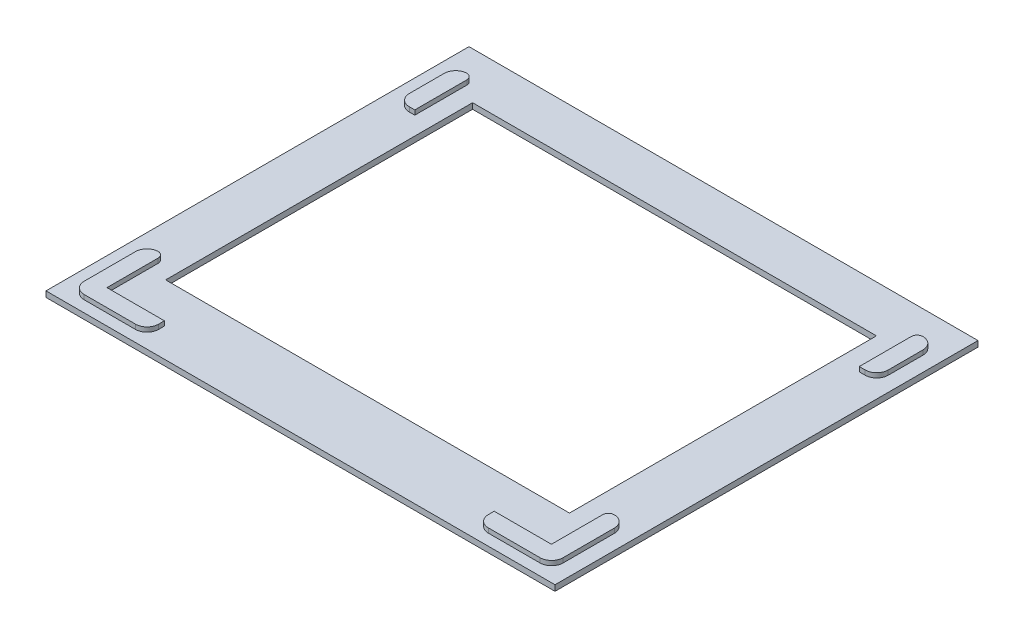
from build123d import *

# Parameters (mm, degrees)
BOSS_EXTRUDE2_DEPTH   = 1.016
BOSS_EXTRUDE2_2_DEPTH = 1.016
SKETCH2_W             = 3.747831998
SKETCH2_H             = 12.799678195
BOSS_EXTRUDE2_3_DEPTH = 1.016
SKETCH2_W_2           = 3.862926877
BOSS_EXTRUDE2_4_DEPTH = 1.016
SKETCH2_7_W           = 112.7125
SKETCH2_7_H           = 93.6625
BOSS_EXTRUDE14_DEPTH  = 1.27
SKETCH2_8_W           = 89.425
SKETCH2_8_H           = 67.9625
CUT_EXTRUDE4_DEPTH    = 1.27
FILLET5_R             = 2.54
FILLET6_R             = 2.54
FILLET7_R             = 2.54
FILLET8_R             = 2.54
FILLET9_R             = 1.27
FILLET10_R            = 1.27
FILLET11_R            = 1.27
FILLET12_R            = 1.27


with BuildPart() as part:
    # Sketch2 → Boss-Extrude2 (new body)
    with BuildSketch(Plane(origin=(0, 0, 0), x_dir=(1, 0, 0), z_dir=(0, 1, 0))):
        Polygon((-52.960331998, -27.870210865), (-52.960331998, -44.318627665), (-36.491625106, -44.318627665), (-36.491625106, -40.48125), (-49.2125, -40.48125), (-49.2125, -27.870210865), align=None)
    extrude(amount=BOSS_EXTRUDE2_DEPTH)



with BuildPart() as body_2:
    # Sketch2 → Boss-Extrude2 2 (new body)
    with BuildSketch(Plane(origin=(0, 0, 0), x_dir=(1, 0, 0), z_dir=(0, 1, 0))):
        Polygon((49.2125, -40.48125), (36.537927314, -40.48125), (36.537927314, -44.318627665), (53.075426877, -44.318627665), (53.075426877, -27.870210865), (49.2125, -27.870210865), align=None)
    extrude(amount=BOSS_EXTRUDE2_2_DEPTH)


with BuildPart() as body_3:
    # Sketch2 → Boss-Extrude2 3 (new body)
    with BuildSketch(Plane(origin=(0, 0, 0), x_dir=(1, 0, 0), z_dir=(0, 1, 0))):
        with Locations((-51.086415999, 34.081410903)):
            Rectangle(SKETCH2_W, SKETCH2_H)
    extrude(amount=BOSS_EXTRUDE2_3_DEPTH)


with BuildPart() as body_4:
    # Sketch2 → Boss-Extrude2 4 (new body)
    with BuildSketch(Plane(origin=(0, 0, 0), x_dir=(1, 0, 0), z_dir=(0, 1, 0))):
        with Locations((51.143963439, 34.081410903)):
            Rectangle(SKETCH2_W_2, SKETCH2_H)
    extrude(amount=BOSS_EXTRUDE2_4_DEPTH)


with BuildPart() as part_1:
    add(part.part)

    add(body_2.part)  # Boss-Extrude14 merges body 2

    add(body_3.part)  # Boss-Extrude14 merges body 3

    add(body_4.part)  # Boss-Extrude14 merges body 4
    # Sketch2<7> → Boss-Extrude14 (add)
    with BuildSketch(Plane(origin=(0, 0, 0), x_dir=(1, 0, 0), z_dir=(0, 1, 0))):
        Rectangle(SKETCH2_7_W, SKETCH2_7_H)
    extrude(amount=-BOSS_EXTRUDE14_DEPTH)

    # Sketch2<8> → Cut-Extrude4 (cut)
    with BuildSketch(Plane(origin=(0, 0, 0), x_dir=(1, 0, 0), z_dir=(0, 1, 0))):
        with Locations((-0.5, 2.5)):
            Rectangle(SKETCH2_8_W, SKETCH2_8_H)
    extrude(amount=-CUT_EXTRUDE4_DEPTH, mode=Mode.SUBTRACT)

    # Fillet5
    fillet5_edges = [part_1.edges().sort_by_distance(p)[0] for p in [
        (-52.960331998, 0.508, -27.681571805),
        (-52.960331998, 0.508, -40.48125),
    ]]
    fillet(fillet5_edges, radius=FILLET5_R)

    # Fillet6
    fillet6_edges = [part_1.edges().sort_by_distance(p)[0] for p in [
        (53.075426877, 0.508, -27.681571805),
        (53.075426877, 0.508, -40.48125),
    ]]
    fillet(fillet6_edges, radius=FILLET6_R)

    # Fillet7
    fillet7_edges = [part_1.edges().sort_by_distance(p)[0] for p in [
        (-52.960331998, 0.508, 27.870210865),
        (-52.960331998, 0.508, 44.318627665),
        (-36.491625106, 0.508, 44.318627665),
    ]]
    fillet(fillet7_edges, radius=FILLET7_R)

    # Fillet8
    fillet8_edges = [part_1.edges().sort_by_distance(p)[0] for p in [
        (36.537927314, 0.508, 44.318627665),
        (53.075426877, 0.508, 44.318627665),
        (53.075426877, 0.508, 27.870210865),
    ]]
    fillet(fillet8_edges, radius=FILLET8_R)

    # Fillet9
    fillet9_edges = [part_1.edges().sort_by_distance(p)[0] for p in [
        (-49.2125, 0.508, 27.870210865),
    ]]
    fillet(fillet9_edges, radius=FILLET9_R)

    # Fillet10
    fillet10_edges = [part_1.edges().sort_by_distance(p)[0] for p in [
        (-49.2125, 0.508, -40.48125),
    ]]
    fillet(fillet10_edges, radius=FILLET10_R)

    # Fillet11
    fillet11_edges = [part_1.edges().sort_by_distance(p)[0] for p in [
        (49.2125, 0.508, 27.870210865),
    ]]
    fillet(fillet11_edges, radius=FILLET11_R)

    # Fillet12
    fillet12_edges = [part_1.edges().sort_by_distance(p)[0] for p in [
        (49.2125, 0.508, -40.48125),
    ]]
    fillet(fillet12_edges, radius=FILLET12_R)


solid = part_1.part
